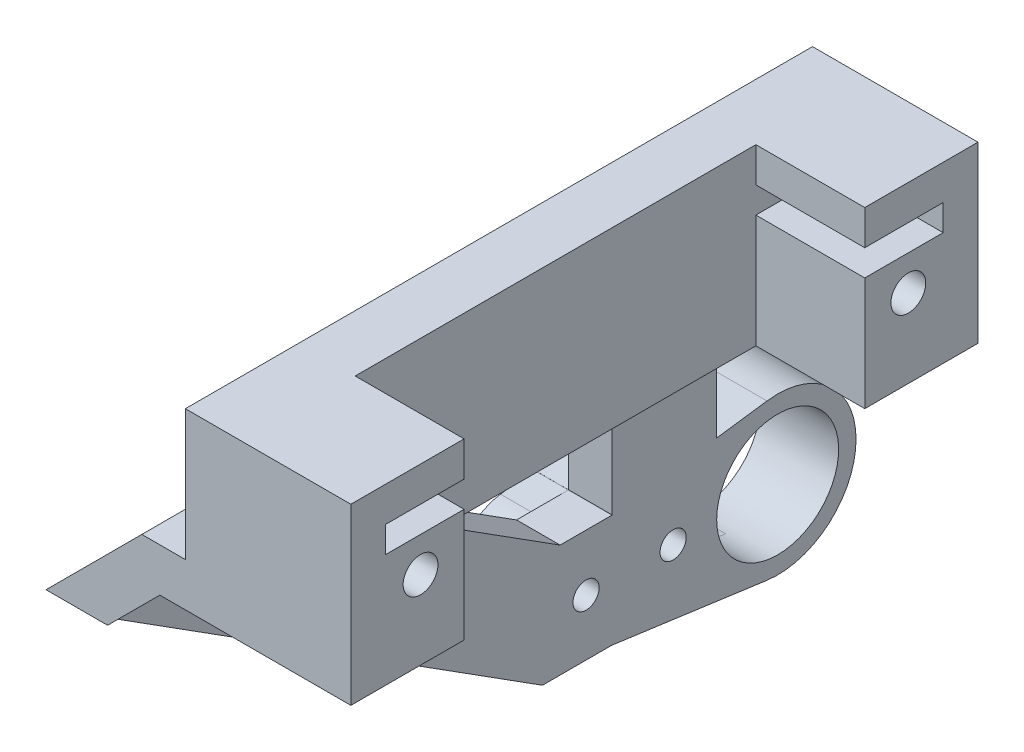
from build123d import *

# Parameters (mm, degrees)
EXTRUDE_1_DEPTH     = 18
CUT_EXTRUDE_1_REACH = 33.788
CUT_EXTRUDE_2_DEPTH = 6.25
SKETCH_4_R          = 1.0000000000000013
CUT_EXTRUDE_3_DEPTH = 10
SKETCH_8_R          = 3.4999999999999996
SKETCH_8_R_2        = 0.751628678477691
SKETCH_8_R_3        = 0.7516286784776927
EXTRUDE_2_DEPTH     = 2.5
EXTRUDE_3_DEPTH     = 2
CUT_EXTRUDE_4_REACH = 39.597
SKETCH_8_4_R        = 0.751628678477691
SKETCH_8_4_R_2      = 0.7516286784776927


# Read off the part's stored shape, not the designer's step: 凸台-拉伸3
with BuildPart() as part:
    # 草图1 → 凸台-拉伸1 (new, symmetric)
    with BuildSketch(Plane.XY):
        Polygon((0, 0), (0, 10), (-9.5, 9.999999999999998), (-9.499999999999998, 2.5000000000000004), (-11.999999999999998, 2.5), (-17.499999999999996, -3.0000000000000218), (-17.499999999999996, -19.5), (-14.999999999999995, -19.500000000000004), (-14.999999999999995, -4.035533905932752), (-10.964466094067257, -4e-17), align=None)
    extrude(amount=EXTRUDE_1_DEPTH, both=True)

    # 草图2 → 切除-拉伸1 (cut, up to next)
    with BuildSketch(Plane.ZY.offset(17.499999999999996), mode=Mode.PRIVATE) as cut_extrude_1_sk1:
        Polygon((-9.011266099163953, -13.03553390593275), (-11.999999999999996, -13.03553390593275), (-11.999999999999998, -4.035533905932751), (1.5000000000000013, -4.035533905932748), (1.500000000000002, -6.364922727617167), align=None)
    cut_extrude_1_tool1 = extrude(cut_extrude_1_sk1.sketch, amount=-CUT_EXTRUDE_1_REACH, mode=Mode.PRIVATE) & part.part
    # 草图2 → 切除-拉伸1 (cut, up to next)
    with BuildSketch(Plane.ZY.offset(17.499999999999996), mode=Mode.PRIVATE) as cut_extrude_1_sk2:
        Polygon((-7.9999999999999964, -19.499999999999996), (18, -19.49999999999999), (18, -3.000000000000014), align=None)
    cut_extrude_1_tool2 = extrude(cut_extrude_1_sk2.sketch, amount=-CUT_EXTRUDE_1_REACH, mode=Mode.PRIVATE) & part.part
    add(cut_extrude_1_tool1.solids().sort_by_distance((-17.5, -7.612266, -6.566584))[0], mode=Mode.SUBTRACT)
    add(cut_extrude_1_tool2.solids().sort_by_distance((-17.5, -14, 9.333333))[0], mode=Mode.SUBTRACT)

    # 草图3 → 切除-拉伸2 (cut, symmetric)
    with BuildSketch(Plane(origin=(0, 8.89452112858794, -0.8331769279117781), x_dir=(0, -1, 0), z_dir=(1, 0, 0))):
        Polygon((2.3945211285879346, 15.166823072088224), (2.3945211285879346, 10.666823072088222), (8.894521128587936, 10.666823072088222), (8.894521128587936, -12.333176927911778), (2.394521128587931, -12.333176927911778), (2.3945211285879346, -16.833176927911776), (0.8945211285879351, -16.833176927911776), (0.8945211285879351, -12.33317692791178), (-3.1054788714120676, -12.333176927911778), (-3.105478871412064, 10.66682307208822), (0.8945211285879369, 10.66682307208822), (0.8945211285879351, 15.166823072088224), align=None)
    extrude(amount=CUT_EXTRUDE_2_DEPTH, both=True, mode=Mode.SUBTRACT)

    # 草图4 → 切除-拉伸3 (cut)
    with BuildSketch(Plane(origin=(0, 0, 0), x_dir=(0, 0, -1), z_dir=(1, 0, 0))):
        with Locations(Location((-14, 4.500000000000008, 0), (0, 0, 90))):
            Circle(SKETCH_4_R)
    cut_extrude_3 = extrude(amount=-CUT_EXTRUDE_3_DEPTH, mode=Mode.SUBTRACT)

    # 镜向1: 切除-拉伸3 across plane
    add(cut_extrude_3.mirror(Plane.XY), mode=Mode.SUBTRACT)

    # 草图8 → 凸台-拉伸2 (add)
    with BuildSketch(Plane.ZY.offset(17.499999999999996)):
        with BuildLine():
            Line((-20.886363636363633, -11.809802124345238), (-10.090909090909088, -13.295790400552288))
            ThreePointArc((-10.090909090909088, -13.295790400552288), (-7.50000000000001, -16.26776695296638), (-10.090909090909088, -19.239743505380464))
            Line((-10.090909090909088, -19.239743505380464), (-20.886363636363633, -20.725731781587513))
            ThreePointArc((-20.886363636363633, -20.725731781587513), (-25.999999999999996, -16.267766952966376), (-20.886363636363633, -11.809802124345238))
        make_face()
        with Locations(Location((-21.5, -16.267766952966376, 0), (0, 0, 270))):
            Circle(SKETCH_8_R, mode=Mode.SUBTRACT)
        with Locations((-15.499999999999998, -16.267766952966372)):
            Circle(SKETCH_8_R_2, mode=Mode.SUBTRACT)
        with Locations((-10.499999999999998, -16.26776695296638)):
            Circle(SKETCH_8_R_3, mode=Mode.SUBTRACT)
    extrude(amount=-EXTRUDE_2_DEPTH)

    # 凸台-拉伸3 outline → 凸台-拉伸3 (add)
    with BuildSketch(Plane.ZY.offset(17.499999999999996)):
        with BuildLine():
            Line((-11.98162869, -13.035533906), (-12, -13.035533906))
            Line((-12, -13.035533906), (-12, -13.033005105))
            Line((-12, -13.033005105), (-20.886363636, -11.809802124))
            ThreePointArc((-20.886363636, -11.809802124), (-26, -16.267766953), (-20.886363636, -20.725731782))
            Line((-20.886363636, -20.725731782), (-10.090909091, -19.239743505))
            ThreePointArc((-10.090909091, -19.239743505), (-7.5, -16.267766953), (-10.090909091, -13.295790401))
            Line((-10.090909091, -13.295790401), (-11.98162869, -13.035533906))
        make_face()
        with BuildLine():
            ThreePointArc((-21.022727273, -19.735072931), (-25, -16.267766953), (-21.022727273, -12.800460975))
            Line((-21.022727273, -12.800460975), (-10.227272727, -14.286449251))
            ThreePointArc((-10.227272727, -14.286449251), (-8.5, -16.267766953), (-10.227272727, -18.249084655))
            Line((-10.227272727, -18.249084655), (-21.022727273, -19.735072931))
        make_face(mode=Mode.SUBTRACT)
    extrude(amount=EXTRUDE_3_DEPTH)

    # 草图8<4> → 切除-拉伸4 (cut, up to next)
    with BuildSketch(Plane.ZY.offset(17.499999999999996), mode=Mode.PRIVATE) as cut_extrude_4_sk1:
        with Locations(Location((-15.499999999999998, -16.267766952966372, 0), (0, 0, 270))):
            Circle(SKETCH_8_4_R)
    cut_extrude_4_tool1 = extrude(cut_extrude_4_sk1.sketch, amount=-CUT_EXTRUDE_4_REACH, mode=Mode.PRIVATE) & part.part
    # 草图8<4> → 切除-拉伸4 (cut, up to next)
    with BuildSketch(Plane.ZY.offset(17.499999999999996), mode=Mode.PRIVATE) as cut_extrude_4_sk2:
        with Locations(Location((-10.499999999999998, -16.26776695296638, 0), (0, 0, 270))):
            Circle(SKETCH_8_4_R_2)
    cut_extrude_4_tool2 = extrude(cut_extrude_4_sk2.sketch, amount=-CUT_EXTRUDE_4_REACH, mode=Mode.PRIVATE) & part.part
    add(cut_extrude_4_tool1.solids().sort_by_distance((-17.5, -16.267767, -15.5))[0], mode=Mode.SUBTRACT)
    add(cut_extrude_4_tool2.solids().sort_by_distance((-17.5, -16.267767, -10.5))[0], mode=Mode.SUBTRACT)


solid = part.part
